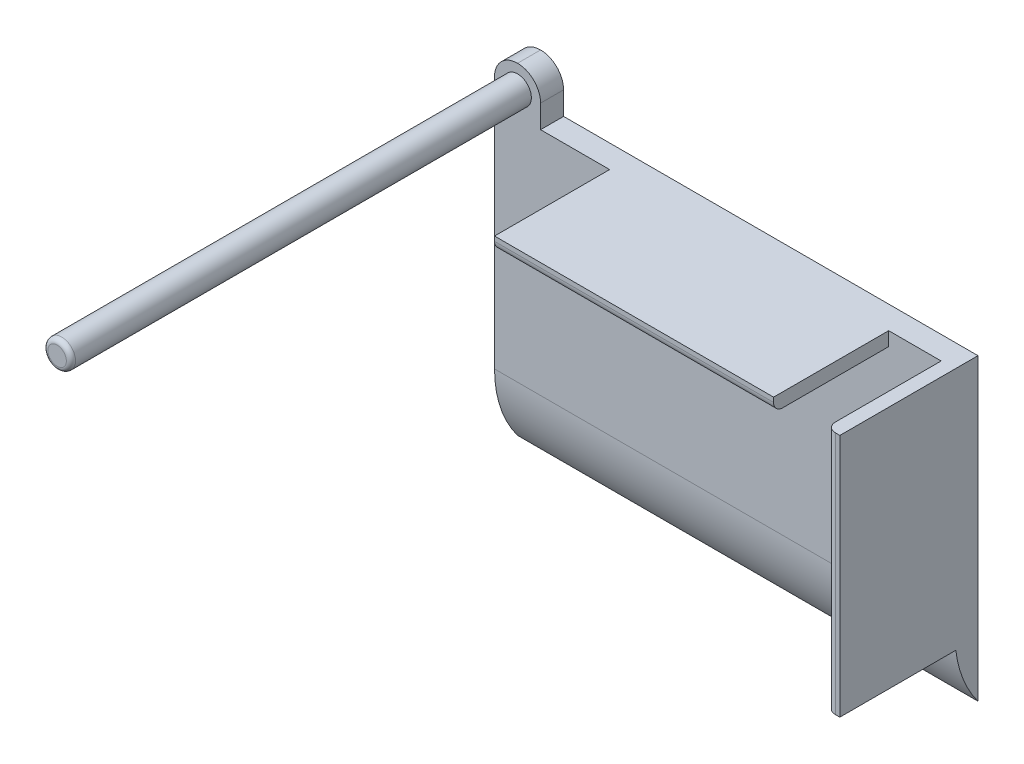
from build123d import *

# Parameters (mm, degrees)
SKETCH1_W           = 100
SKETCH1_H           = 65
BOSS_EXTRUDE2_DEPTH = 5
BOSS_EXTRUDE3_DEPTH = 10
BOSS_EXTRUDE4_DEPTH = 25
BOSS_EXTRUDE5_DEPTH = 100
FILLET1_R           = 5
FILLET2_R           = 25
FILLET5_R           = 1
SKETCH7_W           = 11.396244365786963
SKETCH7_H           = 3.3746398880239497
CUT_EXTRUDE2_DEPTH  = 25
FILLET7_R           = 2


# Some blends are built 0.0001 mm under size
with BuildPart() as part:
    # Sketch1 → Boss-Extrude2 (new body)
    with BuildSketch(Plane.XY):
        Rectangle(SKETCH1_W, SKETCH1_H)
    extrude(amount=BOSS_EXTRUDE2_DEPTH)

    # Sketch3 → Boss-Extrude3 (add)
    with BuildSketch(Plane(origin=(0, 32.499999999999986, 0), x_dir=(1, 0, 0), z_dir=(0, 1, 0))):
        Polygon((-50.00000000000001, -5), (-40.00000000000001, -5), (-40, 0), (-50.00000000000001, 0), align=None)
    extrude(amount=BOSS_EXTRUDE3_DEPTH)

    # Sketch4 → Boss-Extrude4 (add)
    with BuildSketch(Plane.XY.offset(5)):
        Polygon((49.99999999999999, 32.499999999999986), (50, -20.50000000000001), (47, -20.500000000000014), (46.99999999999999, 29.49999999999999), (-25, 29.49999999999999), (-25, 32.499999999999986), align=None)
    extrude(amount=BOSS_EXTRUDE4_DEPTH)

    # Sketch5 → Boss-Extrude5 (add)
    with BuildSketch(Plane.XY.offset(5)):
        with BuildLine():
            ThreePointArc((-48.000000000000014, 37.49999999999999), (-45.000000000000014, 34.49999999999999), (-42.000000000000014, 37.49999999999999))
            Line((-42.000000000000014, 37.49999999999999), (-45.000000000000014, 37.49999999999999))
            Line((-45.000000000000014, 37.49999999999999), (-48.000000000000014, 37.49999999999999))
        make_face()
        with BuildLine():
            Line((-45.000000000000014, 37.49999999999999), (-42.000000000000014, 37.49999999999999))
            ThreePointArc((-42.000000000000014, 37.49999999999999), (-42.87867965644041, 39.621320343559674), (-45.00000000000013, 40.49999999999999))
            Line((-45.000000000000014, 40.49999999999999), (-45.000000000000014, 37.49999999999999))
        make_face()
        with BuildLine():
            Line((-48.000000000000014, 37.49999999999999), (-45.000000000000014, 37.49999999999999))
            Line((-45.000000000000014, 37.49999999999999), (-45.000000000000014, 40.49999999999999))
            ThreePointArc((-45.00000000000013, 40.49999999999999), (-47.121320343559695, 39.621320343559596), (-48.000000000000014, 37.49999999999999))
        make_face()
    extrude(amount=BOSS_EXTRUDE5_DEPTH)

    # Fillet1
    fillet1_edges = [part.edges().sort_by_distance(p)[0] for p in [
        (-50.00000000000001, 42.499999999999986, 2.5),
        (-40, 42.499999999999986, 2.5),
    ]]
    fillet(fillet1_edges, radius=FILLET1_R - 0.0001)  # a hair under: the kernel refuses the full size

    # Fillet2
    # the kernel refuses this fillet: 25 mm, written as the material it takes off along each edge
    with BuildSketch(Plane(origin=(-87.50000000000392, -32.500000000000014, 5), x_dir=(0, 1.1369e-13, -1), z_dir=(1, 0, 0))) as fillet2_piece_1_section:
        with BuildLine():
            CenterArc((25.000000000001705, 14.999999999998728), FILLET2_R, 179.9999999999935, 36.86989764584689)
            Line((1.7053e-12, 15.00000000000157), (0, 0))
            Line((0, 0), (5.000000000000753, 0))
        make_face()
    fillet2_piece_1 = extrude(amount=175.00000000000784, mode=Mode.PRIVATE)
    fillet2_piece_1 = split(fillet2_piece_1, bisect_by=Plane(origin=(47, -26.83563604767285, 3.245395234010585), z_dir=(-1, -1.4e-16, 0)), keep=Keep.TOP, mode=Mode.PRIVATE)
    add(fillet2_piece_1, mode=Mode.SUBTRACT)
    with BuildSketch(Plane(origin=(-87.50000000000392, -32.500000000000014, 5), x_dir=(0, 1.1369e-13, -1), z_dir=(1, 0, 0))) as fillet2_piece_2_section:
        with BuildLine():
            CenterArc((25.000000000001705, 14.999999999998728), FILLET2_R, 179.9999999999935, 36.86989764584689)
            Line((1.7053e-12, 15.00000000000157), (0, 0))
            Line((0, 0), (5.000000000000753, 0))
        make_face()
    fillet2_piece_2 = extrude(amount=175.00000000000784, mode=Mode.PRIVATE)
    fillet2_piece_2 = split(fillet2_piece_2, bisect_by=Plane(origin=(48.49999999999999, -20.500000000000014, 3.245395234010585), z_dir=(1.18e-15, -1, 0)), keep=Keep.TOP, mode=Mode.PRIVATE)
    add(fillet2_piece_2, mode=Mode.SUBTRACT)

    # Fillet5
    fillet5_edges = [part.edges().sort_by_distance(p)[0] for p in [
        (-48.000000000000014, 37.49999999999999, 105),
    ]]
    fillet(fillet5_edges, radius=FILLET5_R)

    # Sketch7 → Cut-Extrude2 (cut)
    with BuildSketch(Plane.XY.offset(30.000000000000004)):
        with Locations((41.301877817106515, 31.187319944011968)):
            Rectangle(SKETCH7_W, SKETCH7_H)
    extrude(amount=-CUT_EXTRUDE2_DEPTH, mode=Mode.SUBTRACT)

    # Fillet7
    fillet7_edges = [part.edges().sort_by_distance(p)[0] for p in [
        (47, 5.999999999999986, 30),
        (5.301877817106508, 29.49999999999999, 30),
    ]]
    fillet(fillet7_edges, radius=FILLET7_R)


solid = part.part
